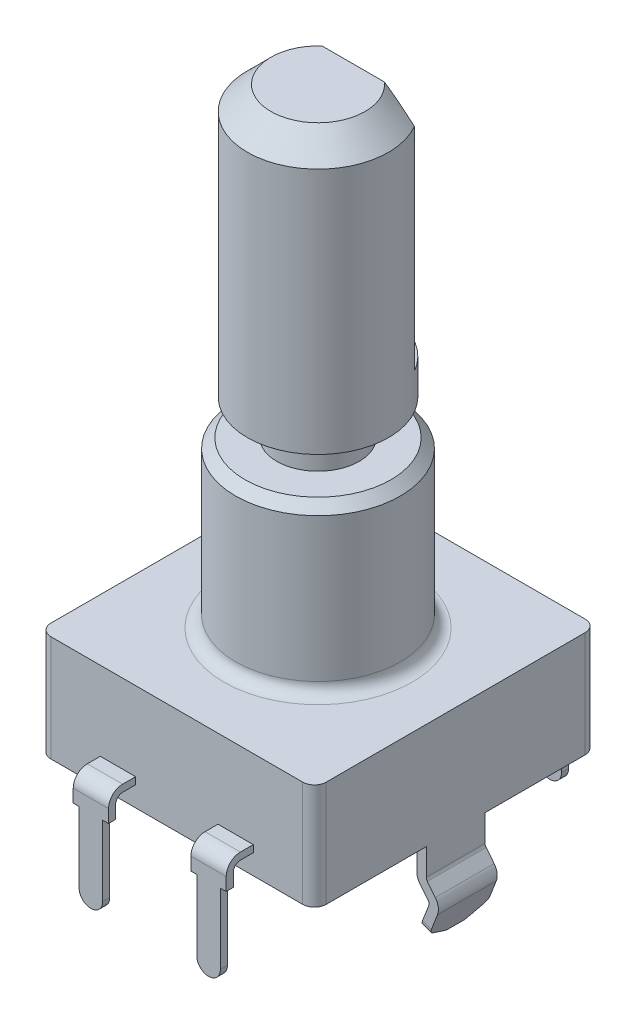
from build123d import *
from OCP.BRepFilletAPI import BRepFilletAPI_MakeChamfer

# Parameters (mm, degrees)
SKETCH_1_W                         = 11.7
SKETCH_1_H                         = 12
EXTRUDE_1_DEPTH                    = 4.5
SKETCH_9_R                         = 3.5
EXTRUDE_2_DEPTH                    = 11.5
SKETCH_10_R                        = 1.75
EXTRUDE_3_DEPTH                    = 1.5
SKETCH_11_R                        = 3
EXTRUDE_4_DEPTH                    = 11.5
CHAMFER_1_SIZE                     = 1
CHAMFER_2_SIZE                     = 0.4
SKETCH_12_W                        = 6
SKETCH_12_H                        = 1.5
CUT_EXTRUDE_1_DEPTH                = 10
FILLET_1_R                         = 0.5
FILLET_2_R                         = 0.5
EXTRUDE_1_2_DEPTH                  = 1.25
CHAMFER_3_SIZE                     = 0.4
CHAMFER_3_SIZE2                    = 0.857802768
FILLET_3_R                         = 0.3
CHAMFER_3_OF_MIRROR_1_SIZE         = 0.4
CHAMFER_3_OF_MIRROR_1_SIZE2        = 0.857802768
FILLET_3_OF_MIRROR_1_R             = 0.3
EXTRUDE_2_2_DEPTH                  = 0.5
EXTRUDE_3_2_DEPTH                  = 0.75
FILLET_4_R                         = 0.5
PATTERN_LINEAR_1_COUNT             = 2
PATTERN_LINEAR_1_PITCH             = 2.5
FILLET_4_OF_PATTERN_LINEAR_1_R     = 0.5
PATTERN_LINEAR_1_COL_COUNT         = 2
PATTERN_LINEAR_1_COL_PITCH         = 2.5
FILLET_4_OF_PATTERN_LINEAR_1_COL_R = 0.5
EXTRUDE_START                      = 2.5
EXTRUDE_4_2_DEPTH                  = 0.5
EXTRUDE_5_DEPTH                    = 0.75
FILLET_5_R                         = 0.5
FILLET_5_OF_MIRROR_2_R             = 0.5


with BuildPart() as part:
    # Эскиз1 → Extrude 1 (new body)
    with BuildSketch(Plane(origin=(0, 0, 0), x_dir=(1, 0, 0), z_dir=(0, 1, 0))):
        Rectangle(SKETCH_1_W, SKETCH_1_H)
    extrude(amount=EXTRUDE_1_DEPTH)

    # Эскиз9 → Extrude 2 (add)
    with BuildSketch(Plane(origin=(0, 0, 0), x_dir=(1, 0, 0), z_dir=(0, 1, 0))):
        with Locations(Location((0, 0, 0), (0, 0, 270))):
            Circle(SKETCH_9_R)
    extrude(amount=EXTRUDE_2_DEPTH)

    # Эскиз10 → Extrude 3 (add)
    with BuildSketch(Plane(origin=(0, 11.5, 0), x_dir=(1, 0, 0), z_dir=(0, 1, 0))):
        with Locations(Location((0, 0, 0), (0, 0, 270))):
            Circle(SKETCH_10_R)
    extrude(amount=EXTRUDE_3_DEPTH)

    # Эскиз11 → Extrude 4 (add)
    with BuildSketch(Plane(origin=(0, 13, 0), x_dir=(1, 0, 0), z_dir=(0, 1, 0))):
        with Locations(Location((0, 0, 0), (0, 0, 270))):
            Circle(SKETCH_11_R)
    extrude(amount=EXTRUDE_4_DEPTH)

    # Фаска1
    chamfer_1_edges = [part.edges().sort_by_distance(p)[0] for p in [
        (0, 24.5, -3),
    ]]
    chamfer(chamfer_1_edges, length=CHAMFER_1_SIZE)

    # Фаска2
    chamfer_2_edges = [part.edges().sort_by_distance(p)[0] for p in [
        (0, 11.5, -3.5),
    ]]
    chamfer(chamfer_2_edges, length=CHAMFER_2_SIZE)

    # Эскиз12 → Вырез-Вытянуть1 (cut)
    with BuildSketch(Plane(origin=(0, 24.5, 0), x_dir=(1, 0, 0), z_dir=(0, 1, 0))):
        with Locations((0, 2.25)):
            Rectangle(SKETCH_12_W, SKETCH_12_H)
    extrude(amount=-CUT_EXTRUDE_1_DEPTH, mode=Mode.SUBTRACT)

    # Скругление1
    fillet_1_edges = [part.edges().sort_by_distance(p)[0] for p in [
        (0, 4.5, -3.5),
    ]]
    fillet(fillet_1_edges, radius=FILLET_1_R)

    # Скругление2
    fillet_2_edges = [part.edges().sort_by_distance(p)[0] for p in [
        (5.85, 2.25, 6),
        (-5.85, 2.25, 6),
        (-5.85, 2.25, -6),
        (5.85, 2.25, -6),
    ]]
    fillet(fillet_2_edges, radius=FILLET_2_R)

    # Эскиз13 → Extrude 1 2 (add, symmetric)
    with BuildSketch(Plane.XY):
        with BuildLine():
            Line((-5.85, 0), (-5.85, -1.129843788))
            ThreePointArc((-5.85, -1.129843788), (-5.861274336, -1.196045176), (-5.893826238, -1.254782798))
            Line((-5.893826238, -1.254782798), (-6.234378942, -1.680473678))
            ThreePointArc((-6.234378942, -1.680473678), (-6.358875719, -1.964024187), (-6.325398516, -2.271887168))
            Line((-6.325398516, -2.271887168), (-5.85, -3.5))
            Line((-5.85, -3.5), (-5.476972761, -3.355602359))
            Line((-5.476972761, -3.355602359), (-5.952371276, -2.127489527))
            ThreePointArc((-5.952371276, -2.127489527), (-5.963530344, -2.024868533), (-5.922031419, -1.930351697))
            Line((-5.922031419, -1.930351697), (-5.581478714, -1.504660817))
            ThreePointArc((-5.581478714, -1.504660817), (-5.483823009, -1.328447953), (-5.45, -1.129843788))
            Line((-5.45, -1.129843788), (-5.45, 0))
            Line((-5.45, 0), (-5.85, 0))
        make_face()
    extrude_1_2 = extrude(amount=EXTRUDE_1_2_DEPTH, both=True)

    # Фаска3: one chamfer whose edges measure the first distance from different faces: ONE call of the kernel's chamfer builder (chamfer() names one face for all edges)
    chamfer_3_edges_1 = [part.edges().sort_by_distance(p)[0] for p in [
        (-5.66348638, -3.427801179, 1.25),
    ]]
    chamfer_3_side_1 = [part.faces().sort_by_distance(p)[0] for p in [
        (-5.837614818, -1.735838174, 1.25),
    ]]
    chamfer_3_edges_2 = [part.edges().sort_by_distance(p)[0] for p in [
        (-5.66348638, -3.427801179, -1.25),
    ]]
    chamfer_3_side_2 = [part.faces().sort_by_distance(p)[0] for p in [
        (-5.837614818, -1.735838174, -1.25),
    ]]
    chamfer_3 = BRepFilletAPI_MakeChamfer(part.part.solid().wrapped)
    for e in chamfer_3_edges_1:
        chamfer_3.Add(CHAMFER_3_SIZE, CHAMFER_3_SIZE2, e.wrapped, chamfer_3_side_1[0].wrapped)  # the first distance lies on this face
    for e in chamfer_3_edges_2:
        chamfer_3.Add(CHAMFER_3_SIZE, CHAMFER_3_SIZE2, e.wrapped, chamfer_3_side_2[0].wrapped)  # the first distance lies on this face
    add(Compound.cast(chamfer_3.Shape()), mode=Mode.REPLACE)

    # Скругление3
    fillet_3_edges = [part.edges().sort_by_distance(p)[0] for p in [
        (-5.807884021, -3.05477394, -1.25),
        (-5.66348638, -3.427801179, 0.392197232),
        (-5.66348638, -3.427801179, -0.392197232),
        (-5.807884021, -3.05477394, 1.25),
    ]]
    fillet(fillet_3_edges, radius=FILLET_3_R)

    # Зеркальное отражение1: Extrude 1 2 across plane
    add(extrude_1_2.mirror(Plane(origin=(0, 0, 0), x_dir=(0, 0, 1), z_dir=(1, 0, 0))))

    # Фаска3 of Зеркальное отражение1: one chamfer whose edges measure the first distance from different faces: ONE call of the kernel's chamfer builder (chamfer() names one face for all edges)
    chamfer_3_of_mirror_1_edges_1 = [part.edges().sort_by_distance(p)[0] for p in [
        (5.66348638, -3.427801179, 1.25),
    ]]
    chamfer_3_of_mirror_1_side_1 = [part.faces().sort_by_distance(p)[0] for p in [
        (5.837614818, -1.735838174, 1.25),
    ]]
    chamfer_3_of_mirror_1_edges_2 = [part.edges().sort_by_distance(p)[0] for p in [
        (5.66348638, -3.427801179, -1.25),
    ]]
    chamfer_3_of_mirror_1_side_2 = [part.faces().sort_by_distance(p)[0] for p in [
        (5.837614818, -1.735838174, -1.25),
    ]]
    chamfer_3_of_mirror_1 = BRepFilletAPI_MakeChamfer(part.part.solid().wrapped)
    for e in chamfer_3_of_mirror_1_edges_1:
        chamfer_3_of_mirror_1.Add(CHAMFER_3_OF_MIRROR_1_SIZE, CHAMFER_3_OF_MIRROR_1_SIZE2, e.wrapped, chamfer_3_of_mirror_1_side_1[0].wrapped)  # the first distance lies on this face
    for e in chamfer_3_of_mirror_1_edges_2:
        chamfer_3_of_mirror_1.Add(CHAMFER_3_OF_MIRROR_1_SIZE, CHAMFER_3_OF_MIRROR_1_SIZE2, e.wrapped, chamfer_3_of_mirror_1_side_2[0].wrapped)  # the first distance lies on this face
    add(Compound.cast(chamfer_3_of_mirror_1.Shape()), mode=Mode.REPLACE)

    # Скругление3 of Зеркальное отражение1
    fillet_3_of_mirror_1_edges = [part.edges().sort_by_distance(p)[0] for p in [
        (5.807884021, -3.05477394, -1.25),
        (5.66348638, -3.427801179, 0.392197232),
        (5.66348638, -3.427801179, -0.392197232),
        (5.807884021, -3.05477394, 1.25),
    ]]
    fillet(fillet_3_of_mirror_1_edges, radius=FILLET_3_OF_MIRROR_1_R)

    # Эскиз14 → Extrude 2 2 (add, symmetric)
    with BuildSketch(Plane(origin=(0, 0, 0), x_dir=(0, 0, -1), z_dir=(1, 0, 0))):
        with BuildLine():
            Line((6, 0.85), (7.05, 0.85))
            ThreePointArc((7.05, 0.85), (7.262132034, 0.762132034), (7.35, 0.55))
            Line((7.35, 0.55), (7.35, -3.5))
            Line((7.35, -3.5), (7.65, -3.5))
            Line((7.65, -3.5), (7.65, 0.55))
            ThreePointArc((7.65, 0.55), (7.474264069, 0.974264069), (7.05, 1.15))
            Line((7.05, 1.15), (6, 1.15))
            Line((6, 1.15), (6, 0.85))
        make_face()
    extrude_2_2 = extrude(amount=EXTRUDE_2_2_DEPTH, both=True)

    # Эскиз15 → Extrude 3 2 (add, symmetric)
    with BuildSketch(Plane(origin=(0, 0, 0), x_dir=(0, 0, -1), z_dir=(1, 0, 0))):
        with BuildLine():
            Line((6, 0.85), (7.05, 0.85))
            ThreePointArc((7.05, 0.85), (7.262132034, 0.762132034), (7.35, 0.55))
            Line((7.35, 0.55), (7.35, 0))
            Line((7.35, 0), (7.65, 0))
            Line((7.65, 0), (7.65, 0.55))
            ThreePointArc((7.65, 0.55), (7.474264069, 0.974264069), (7.05, 1.15))
            Line((7.05, 1.15), (6, 1.15))
            Line((6, 1.15), (6, 0.85))
        make_face()
    extrude_3_2 = extrude(amount=EXTRUDE_3_2_DEPTH, both=True)

    # Скругление4
    fillet_4_edges = [part.edges().sort_by_distance(p)[0] for p in [
        (-0.5, -3.5, -7.5),
        (0.5, -3.5, -7.5),
    ]]
    fillet(fillet_4_edges, radius=FILLET_4_R - 0.0001)  # a hair under: the kernel refuses the full size

    # Линейный массив1: Extrude 2 2, Extrude 3 2 ×2
    with Locations(*[(i * PATTERN_LINEAR_1_PITCH, 0, 0) for i in range(1, PATTERN_LINEAR_1_COUNT)]):
        add(extrude_2_2)
        add(extrude_3_2)

    # Скругление4 of Линейный массив1
    fillet_4_of_pattern_linear_1_edges = [part.edges().sort_by_distance(p)[0] for p in [
        (2, -3.5, -7.5),
        (3, -3.5, -7.5),
    ]]
    fillet(fillet_4_of_pattern_linear_1_edges, radius=FILLET_4_OF_PATTERN_LINEAR_1_R - 0.0001)  # a hair under: the kernel refuses the full size

    # Линейный массив1 col: Extrude 2 2, Extrude 3 2 ×2
    with Locations(*[(-i * PATTERN_LINEAR_1_COL_PITCH, 0, 0) for i in range(1, PATTERN_LINEAR_1_COL_COUNT)]):
        add(extrude_2_2)
        add(extrude_3_2)

    # Скругление4 of Линейный массив1 col
    fillet_4_of_pattern_linear_1_col_edges = [part.edges().sort_by_distance(p)[0] for p in [
        (-3, -3.5, -7.5),
        (-2, -3.5, -7.5),
    ]]
    fillet(fillet_4_of_pattern_linear_1_col_edges, radius=FILLET_4_OF_PATTERN_LINEAR_1_COL_R - 0.0001)  # a hair under: the kernel refuses the full size

    # Эскиз16 → Extrude 4 2 (add, symmetric)
    with BuildSketch(Plane(origin=(0, 0, 0), x_dir=(0, 0, -1), z_dir=(1, 0, 0)).offset(EXTRUDE_START)):
        with BuildLine():
            Line((-6, 1.15), (-6.55, 1.15))
            ThreePointArc((-6.55, 1.15), (-6.974264069, 0.974264069), (-7.15, 0.55))
            Line((-7.15, 0.55), (-7.15, -3.5))
            Line((-7.15, -3.5), (-6.85, -3.5))
            Line((-6.85, -3.5), (-6.85, 0.55))
            ThreePointArc((-6.85, 0.55), (-6.762132034, 0.762132034), (-6.55, 0.85))
            Line((-6.55, 0.85), (-6, 0.85))
            Line((-6, 0.85), (-6, 1.15))
        make_face()
    extrude_4_2 = extrude(amount=EXTRUDE_4_2_DEPTH, both=True)

    # Эскиз17 → Вытянуть-Тонкостенный5 (add, symmetric)
    with BuildSketch(Plane(origin=(0, 0, 0), x_dir=(0, 0, -1), z_dir=(1, 0, 0)).offset(EXTRUDE_START)):
        with BuildLine():
            Line((-6, 1.15), (-6.55, 1.15))
            ThreePointArc((-6.55, 1.15), (-6.974264069, 0.974264069), (-7.15, 0.55))
            Line((-7.15, 0.55), (-7.15, 0))
            Line((-7.15, 0), (-6.85, 0))
            Line((-6.85, 0), (-6.85, 0.55))
            ThreePointArc((-6.85, 0.55), (-6.762132034, 0.762132034), (-6.55, 0.85))
            Line((-6.55, 0.85), (-6, 0.85))
            Line((-6, 0.85), (-6, 1.15))
        make_face()
    extrude_5 = extrude(amount=EXTRUDE_5_DEPTH, both=True)

    # Скругление5
    fillet_5_edges = [part.edges().sort_by_distance(p)[0] for p in [
        (3, -3.5, 7),
        (2, -3.5, 7),
    ]]
    fillet(fillet_5_edges, radius=FILLET_5_R - 0.0001)  # a hair under: the kernel refuses the full size

    # Зеркальное отражение2: Extrude 4 2, Вытянуть-Тонкостенный5 across plane
    add(extrude_4_2.mirror(Plane(origin=(0, 0, 0), x_dir=(0, 0, 1), z_dir=(1, 0, 0))))
    add(extrude_5.mirror(Plane(origin=(0, 0, 0), x_dir=(0, 0, 1), z_dir=(1, 0, 0))))

    # Скругление5 of Зеркальное отражение2
    fillet_5_of_mirror_2_edges = [part.edges().sort_by_distance(p)[0] for p in [
        (-3, -3.5, 7),
        (-2, -3.5, 7),
    ]]
    fillet(fillet_5_of_mirror_2_edges, radius=FILLET_5_OF_MIRROR_2_R - 0.0001)  # a hair under: the kernel refuses the full size


solid = part.part
